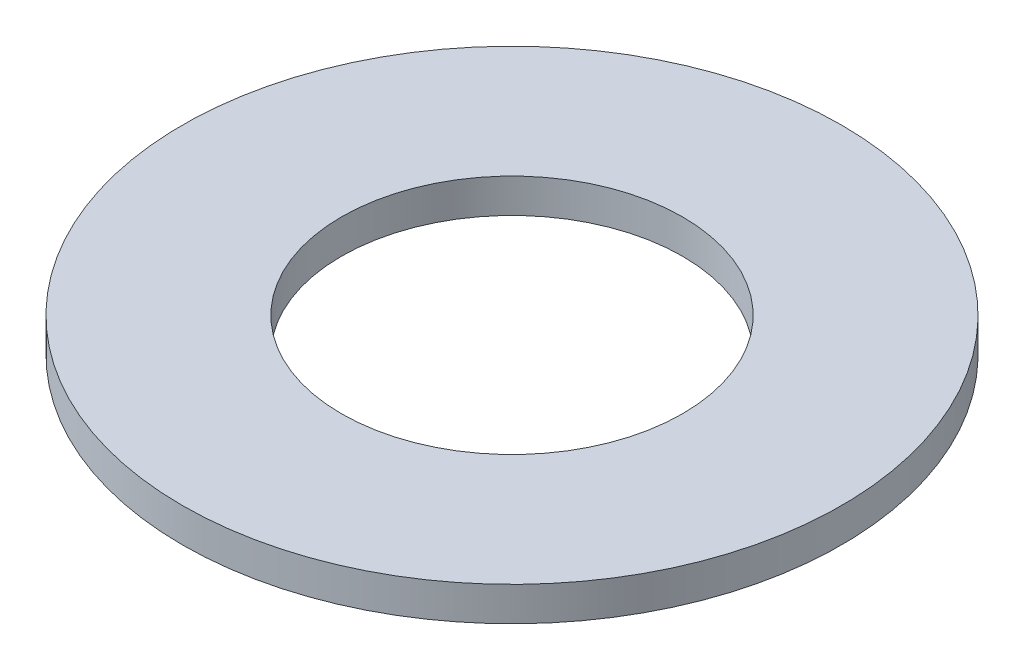
from build123d import *

# Parameters (mm, degrees)
SKETCH1_R           = 22.21
SKETCH1_R_2         = 11.4935
BOSS_EXTRUDE1_DEPTH = 2.3


with BuildPart() as part:
    # Sketch1 → Boss-Extrude1 (new body)
    with BuildSketch(Plane(origin=(0, 0, 0), x_dir=(1, 0, 0), z_dir=(0, 1, 0))):
        Circle(SKETCH1_R)
        Circle(SKETCH1_R_2, mode=Mode.SUBTRACT)
    extrude(amount=BOSS_EXTRUDE1_DEPTH)


solid = part.part
